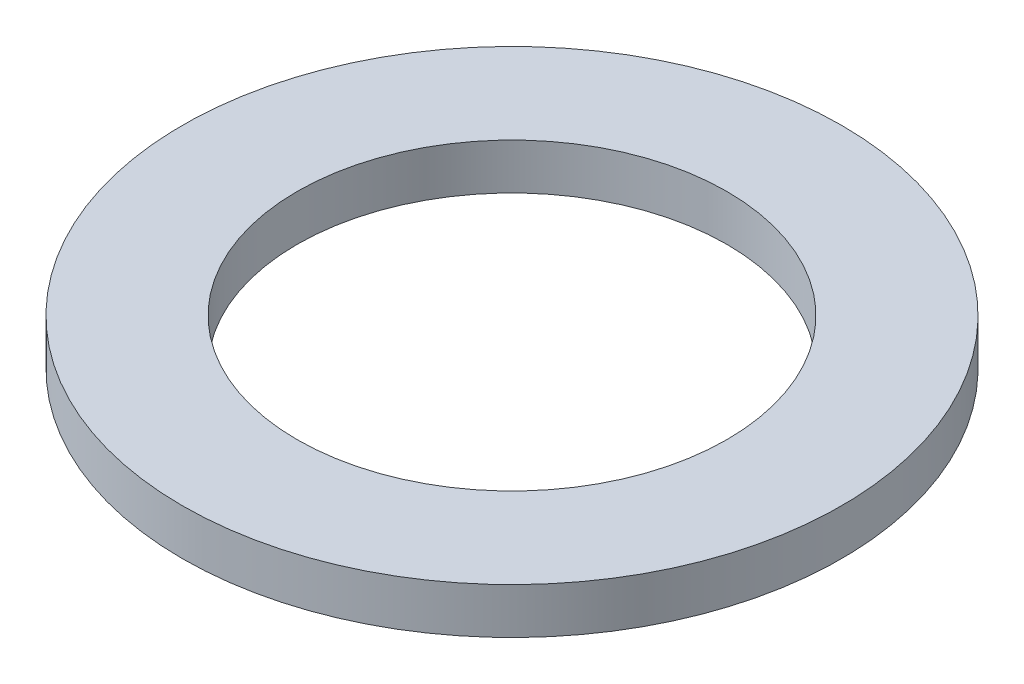
from build123d import *

# Parameters (mm, degrees)
SKETCH1_R           = 57.5
BOSS_EXTRUDE1_DEPTH = 8
SKETCH2_R           = 37.5
CUT_EXTRUDE1_DEPTH  = 82.709852527


with BuildPart() as part:
    # Sketch1 → Boss-Extrude1 (new body)
    with BuildSketch(Plane(origin=(0, 0, 0), x_dir=(1, 0, 0), z_dir=(0, 1, 0))):
        Circle(SKETCH1_R)
    extrude(amount=BOSS_EXTRUDE1_DEPTH)

    # Sketch2 → Cut-Extrude1 (cut, through all)
    with BuildSketch(Plane(origin=(0, 0, 0), x_dir=(1, 0, 0), z_dir=(0, 1, 0))):
        Circle(SKETCH2_R)
    extrude(amount=CUT_EXTRUDE1_DEPTH, mode=Mode.SUBTRACT)


solid = part.part
